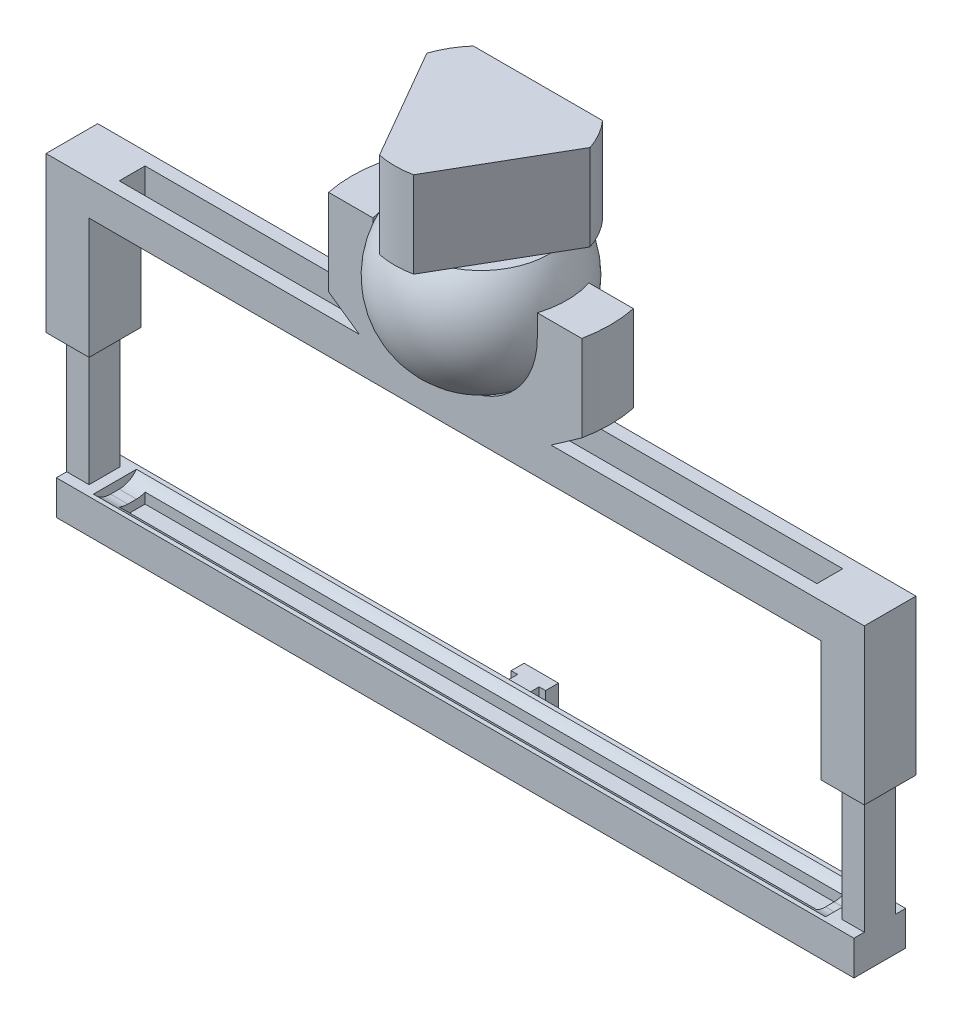
from build123d import *
from build123d.topology import SkipClean

# Parameters (mm, degrees)
BOSS_EXTRUDE1_DEPTH  = 6
SKETCH3_W            = 170.00000000000003
SKETCH3_H            = 10
CUT_EXTRUDE1_DEPTH   = 2
FILLET1_R            = 5
CUT_EXTRUDE2_START   = -72
SKETCH4_W            = 162
SKETCH4_H            = 6
CUT_EXTRUDE2_DEPTH   = 72
BOSS_EXTRUDE6_DEPTH  = 10
SKETCH11_W           = 6
SKETCH11_H           = 8.000000000000005
CUT_EXTRUDE4_DEPTH   = 20
SKETCH12_W           = 5.199999999999989
SKETCH12_H           = 7.200000000000005
BOSS_EXTRUDE7_DEPTH  = 55
SKETCH13_W           = 7.600000000000136
SKETCH13_H           = 12.000000000000005
BOSS_EXTRUDE8_DEPTH  = 8
BOSS_EXTRUDE9_DEPTH  = 72
CUT_EXTRUDE5_START   = -8
CUT_EXTRUDE5_DEPTH   = 8
BOSS_EXTRUDE10_DEPTH = 40
BOSS_EXTRUDE11_DEPTH = 31.5
SKETCH20_W           = 1.7999999999999998
SKETCH20_H           = 1.1499999999999995
CUT_EXTRUDE6_DEPTH   = 1
SKETCH21_W           = 1.4999999999999911
SKETCH21_H           = 1.5000000000000009
SKETCH21_W_2         = 1.5000000000000142
BOSS_EXTRUDE12_DEPTH = 1
CUT_EXTRUDE7_DEPTH   = 7.5
SKETCH23_W           = 1.5000000000000133
SKETCH23_H           = 1.5000000000000009
SKETCH23_W_2         = 1.499999999999993
BOSS_EXTRUDE13_DEPTH = 7.5
SKETCH24_W           = 162
SKETCH24_H           = 6
BOSS_EXTRUDE14_DEPTH = 4
CUT_EXTRUDE8_DEPTH   = 202.79444987412327
CUT_EXTRUDE9_DEPTH   = 36
SKETCH29_W           = 13.300000000000004
SKETCH29_H           = 1.000000000000008
BOSS_EXTRUDE15_DEPTH = 4
BOSS_EXTRUDE16_DEPTH = 5
SKETCH31_R           = 20
BOSS_EXTRUDE17_DEPTH = 20
CUT_EXTRUDE10_DEPTH  = 20
CIRPATTERN1_COUNT    = 3


with BuildPart() as part:
    # Sketch2 → Boss-Extrude1 (new, symmetric)
    with BuildSketch(Plane.XY):
        Polygon((-85.00000000000001, 36.00000000000002), (84.99999999999999, 35.999999999999986), (85.00000000000001, 27.99999999999999), (-85.00000000000001, 27.999999999999968), align=None)
    extrude(amount=BOSS_EXTRUDE1_DEPTH, both=True)

    # Sketch3 → Cut-Extrude1 (cut)
    with BuildSketch(Plane.XZ.offset(-27.99999999999998)):
        Rectangle(SKETCH3_W, SKETCH3_H)
    extrude(amount=-CUT_EXTRUDE1_DEPTH, mode=Mode.SUBTRACT)

    # Fillet1
    # the kernel refuses this fillet: 5 mm, written as the material it adds along each edge
    with BuildSketch(Plane(origin=(85.00000000000001, 29.99999999999999, -5), x_dir=(1.3e-16, -1, 0), z_dir=(-1, -1.3e-16, 0))) as fillet1_piece_1:
        with BuildLine():
            CenterArc((5, 3.9999999999999996), FILLET1_R, 180, 53.13010235415595)
            Line((0, 3.9999999999999996), (-0.10000000000000142, 3.9999999999999996))
            Line((-0.10000000000000142, 3.9999999999999996), (-0.10000000000000142, 0))
            Line((-0.10000000000000142, 0), (0, -0.09999999999999964))
            ThreePointArc((0, -0.09999999999999964), (1, -0.09999999999999964), (1.9400000000000013, -0.08000000000000007))
            Line((1.9400000000000013, -0.08000000000000007), (2, 0))
        make_face()
    extrude(amount=170.00000000000003)
    with BuildSketch(Plane(origin=(-85.00000000000001, 29.999999999999968, 5), x_dir=(0, 0, -1), z_dir=(1, 1.3e-16, 0))) as fillet1_piece_2:
        with BuildLine():
            CenterArc((4, -5), FILLET1_R, 90, 53.13010235415598)
            Line((0, -2), (-0.08000000000000007, -1.9400000000000013))
            ThreePointArc((-0.08000000000000007, -1.9400000000000013), (-0.09999999999999964, -1), (-0.09999999999999964, 0))
            Line((-0.09999999999999964, 0), (0, 0.10000000000000142))
            Line((0, 0.10000000000000142), (4, 0.10000000000000142))
            Line((4, 0.10000000000000142), (4, 0))
        make_face()
    extrude(amount=170.00000000000003)


with BuildPart() as body_2:
    # Mirror3: mirrored copy
    add(part.part.mirror(Plane.ZX))


with BuildPart() as cut_extrude2_tool:
    # Sketch4 → Cut-Extrude2 (new body)
    with BuildSketch(Plane(origin=(7.35e-15, 36.00000000000001, 0), x_dir=(1, -1e-16, 0), z_dir=(1e-16, 1, 0)).offset(CUT_EXTRUDE2_START)):
        Rectangle(SKETCH4_W, SKETCH4_H)
    extrude(amount=CUT_EXTRUDE2_DEPTH)


with BuildPart() as part_1:
    add(part.part)

    # Cut-Extrude2: cut by cut_extrude2_tool
    add(cut_extrude2_tool.part, mode=Mode.SUBTRACT)

    # Sketch10 → Boss-Extrude6 (add)
    with BuildSketch(Plane(origin=(85.00000000000011, 2.949e-13, 0), x_dir=(0, 0, -1), z_dir=(1, 3.47e-15, 0))):
        Polygon((-6, 35.99999999999969), (6, 35.99999999999969), (6.000000000000005, 0), (-6, 0), align=None)
    boss_extrude6 = extrude(amount=BOSS_EXTRUDE6_DEPTH)

    # Sketch11 → Cut-Extrude4 (cut)
    with BuildSketch(Plane.XZ):
        with Locations((90.00000000000011, -2.66e-15)):
            Rectangle(SKETCH11_W, SKETCH11_H)
    cut_extrude4 = extrude(amount=-CUT_EXTRUDE4_DEPTH, mode=Mode.SUBTRACT)

    # Mirror4: Boss-Extrude6, Cut-Extrude4 across plane
    add(boss_extrude6.mirror(Plane(origin=(0, 0, 0), x_dir=(0, 0, 1), z_dir=(1, 0, 0))))
    add(cut_extrude4.mirror(Plane(origin=(0, 0, 0), x_dir=(0, 0, 1), z_dir=(1, 0, 0))), mode=Mode.SUBTRACT)



with BuildPart() as body_2_1:
    add(body_2.part)

    # Cut-Extrude2: cut by cut_extrude2_tool
    add(cut_extrude2_tool.part, mode=Mode.SUBTRACT)



with BuildPart() as body_3:
    # Sketch12 → Boss-Extrude7 (new body)
    with BuildSketch(Plane(origin=(-6.592e-14, 19, 0), x_dir=(-1, -3.47e-15, 0), z_dir=(3.47e-15, -1, 0))):
        with Locations((-90.00000000000011, 2.22e-15)):
            Rectangle(SKETCH12_W, SKETCH12_H)
    extrude(amount=BOSS_EXTRUDE7_DEPTH)


with BuildPart() as body_2_2:
    add(body_2_1.part)

    add(body_3.part)  # Boss-Extrude8 merges body 3
    # Sketch13 → Boss-Extrude8 (add)
    with BuildSketch(Plane.XZ.offset(36.00000000000001)):
        with Locations((88.80000000000018, -2.66e-15)):
            Rectangle(SKETCH13_W, SKETCH13_H)
    boss_extrude8 = extrude(amount=-BOSS_EXTRUDE8_DEPTH)

    # Mirror7: Boss-Extrude8 across plane
    add(boss_extrude8.mirror(Plane(origin=(0, 0, 0), x_dir=(0, 0, 1), z_dir=(1, 0, 0))))


with BuildPart() as body_3_2:
    # Mirror9: mirrored copy
    add(body_2_2.part.mirror(Plane(origin=(0, 0, 0), x_dir=(0, 0, 1), z_dir=(1, 0, 0))))


with BuildPart() as part_2:
    add(part_1.part)

    add(body_2_2.part)  # Boss-Extrude9 merges body 2

    add(body_3_2.part)  # Boss-Extrude9 merges body 3 2
    # Sketch16 → Boss-Extrude9 (add)
    with BuildSketch(Plane(origin=(7.35e-15, 36.00000000000001, 0), x_dir=(1, -2e-16, 0), z_dir=(2e-16, 1, 0))):
        Polygon((-2.5, 6), (2.5, 6), (2.5, 11), (4, 11), (4, 14.000000000000002), (-4, 13.999999999999998), (-4, 11), (-2.5, 11), align=None)
    extrude(amount=-BOSS_EXTRUDE9_DEPTH)

    # Sketch17 → Cut-Extrude5 (cut)
    with BuildSketch(Plane(origin=(-6.07e-15, 0, -14), x_dir=(-1, 0, 4.3e-16), z_dir=(-4.3e-16, 0, -1)).offset(CUT_EXTRUDE5_START)):
        Polygon((-3.9999999999999982, 31), (4.000000000000005, 31.000000000000004), (4.000000000000005, -31.000000000000004), (-3.9999999999999907, -31), align=None)
    extrude(amount=CUT_EXTRUDE5_DEPTH, mode=Mode.SUBTRACT)


with BuildPart() as cut_extrude5_piece_1:
    # of the separate pieces the step leaves, piece 1, a body of its own (cut_extrude5_pieces)
    add(part_2.part.solids().sort_by_distance((85, 28, -5))[0])

    # Sketch20 → Cut-Extrude6 (cut)
    with BuildSketch(Plane.XZ.offset(-27.99999999999998)):
        with Locations((-5.750000000000002, -5.425000000000001)):
            Rectangle(SKETCH20_W, SKETCH20_H)
        Polygon((6.649999999999999, -6), (4.849999999999999, -6), (4.850000000000002, -4.85), (6.650000000000002, -4.849999999999999), align=None)
    extrude(amount=-CUT_EXTRUDE6_DEPTH, mode=Mode.SUBTRACT)

    # Sketch22 → Cut-Extrude7 (cut)
    with BuildSketch(Plane(origin=(7.35e-15, 36.00000000000001, 0), x_dir=(1, -2e-16, 0), z_dir=(2e-16, 1, 0))):
        Polygon((4.850000000000007, 6), (6.65, 6), (6.65, 4.849999999999999), (4.850000000000002, 4.849999999999999), align=None)
        Polygon((-4.850000000000001, 4.849999999999998), (-6.649999999999999, 4.849999999999997), (-6.65, 6), (-4.850000000000007, 6), align=None)
    extrude(amount=-CUT_EXTRUDE7_DEPTH, mode=Mode.SUBTRACT)



with BuildPart() as cut_extrude5_piece_2:
    # of the separate pieces the step leaves, piece 2, a body of its own (cut_extrude5_pieces)
    add(part_2.part.solids().sort_by_distance((85, -30, 1))[0])

    # Sketch24 → Boss-Extrude14 (add)
    with BuildSketch(Plane.XZ.offset(36.00000000000001)):
        Rectangle(SKETCH24_W, SKETCH24_H)
    extrude(amount=-BOSS_EXTRUDE14_DEPTH)


with BuildPart() as body_3_3:
    # Sketch18 → Boss-Extrude10 (new body)
    with BuildSketch(Plane(origin=(7.35e-15, 36.00000000000001, 0), x_dir=(1, -2e-16, 0), z_dir=(2e-16, 1, 0))):
        Polygon((-5, 6.500000000000001), (-5.000000000000003, 14.500000000000002), (5.000000000000003, 14.500000000000002), (5, 6.500000000000001), (6.500000000000001, 6.500000000000001), (6.500000000000001, 16.000000000000004), (-6.500000000000001, 16.000000000000004), (-6.500000000000001, 6.500000000000001), align=None)
    extrude(amount=-BOSS_EXTRUDE10_DEPTH)

    # Sketch19 → Boss-Extrude11 (add)
    with BuildSketch(Plane.XZ.offset(3.9999999999999964)):
        Polygon((-6.500000000000002, -6.500000000000001), (6.5, -6.500000000000001), (6.5, -5), (-6.500000000000005, -5), align=None)
    extrude(amount=-BOSS_EXTRUDE11_DEPTH)

    # Sketch21 → Boss-Extrude12 (add)
    with BuildSketch(Plane(origin=(-3.37e-15, 27.49999999999998, 0), x_dir=(1, 1.2e-16, 0), z_dir=(-1.2e-16, 1, 0))):
        with Locations((5.750000000000007, 5.75)):
            Rectangle(SKETCH21_W, SKETCH21_H)
        with Locations((-5.749999999999996, 5.75)):
            Rectangle(SKETCH21_W_2, SKETCH21_H)
    extrude(amount=BOSS_EXTRUDE12_DEPTH)

    # Sketch23 → Boss-Extrude13 (add)
    with BuildSketch(Plane(origin=(0, 28.49999999999998, 0), x_dir=(1, 0, 0), z_dir=(0, 1, 0))):
        with Locations((-5.749999999999998, 5.75)):
            Rectangle(SKETCH23_W, SKETCH23_H)
        with Locations((5.750000000000004, 5.75)):
            Rectangle(SKETCH23_W_2, SKETCH23_H)
    extrude(amount=BOSS_EXTRUDE13_DEPTH)


with BuildPart() as cut_extrude5_piece_1_1:
    add(cut_extrude5_piece_1.part)

    add(body_3_3.part)  # Revolve4 merges body 3 3
    # Sketch25 → Revolve4 (revolve)
    with BuildSketch(Plane.XY):
        with BuildLine():
            Line((-17.5, 32.00000000000001), (0, 32.00000000000001))
            Line((0, 32.00000000000001), (-3.67e-15, 36.00000000000002))
            ThreePointArc((-3.89e-15, 36.000000000000014), (-14.142135623730956, 41.85786437626906), (-20.000000000000004, 56.00000000000002))
            Line((-20.000000000000007, 56.00000000000002), (-30, 56.00000000000002))
            Line((-30, 56.00000000000002), (-30, 41.00000000000002))
            Line((-30, 41.00000000000002), (-17.5, 32.00000000000001))
        make_face()
        Polygon((30, 61.00000000000002), (30, 56.00000000000002), (20.000000000000007, 56.00000000000002), (20, 61.00000000000002), align=None)
    revolve(axis=Axis((-3.67e-15, 36.00000000000002, 0), (1.8e-16, 1, 0)))

    # Sketch26 → Cut-Extrude8 (cut, through all)
    with BuildSketch(Plane.ZY.offset(95.00000000000011)):
        Polygon((-6.000000000000001, 31.999999999999993), (-30, 31.999999999999993), (-30, 61.00000000000003), (-6.000000000000006, 61.00000000000003), (-6, 35.999999999999936), align=None)
        Polygon((30, 61.00000000000003), (30, 31.999999999999993), (6, 31.999999999999947), (6, 35.999999999999936), (5.999999999999999, 61.00000000000003), align=None)
    extrude(amount=-CUT_EXTRUDE8_DEPTH, mode=Mode.SUBTRACT)

    # Sketch28 → Cut-Extrude9 (cut)
    with BuildSketch(Plane.XZ.offset(3.9999999999999964)):
        Polygon((6.5, -16.000000000000004), (6.5, -5), (-6.500000000000005, -5), (-6.500000000000002, -16.000000000000004), align=None)
    extrude(amount=-CUT_EXTRUDE9_DEPTH, mode=Mode.SUBTRACT)

    # Sketch29 → Boss-Extrude15 (add)
    with BuildSketch(Plane.XZ.offset(-27.99999999999998)):
        with Locations((0, -5.4999999999999964)):
            Rectangle(SKETCH29_W, SKETCH29_H)
    extrude(amount=-BOSS_EXTRUDE15_DEPTH)


with BuildPart() as body_3_4:
    # Sketch27 → Revolve6 (revolve)
    with SkipClean():  # the faces are left unmerged after this step: merging them gives an invalid solid
        with BuildSketch(Plane.XY):
            with BuildLine():
                ThreePointArc((19.7, 56.00000000000002), (13.930003589374987, 69.930003589375), (1.21e-15, 75.70000000000002))
                Line((0, 75.70000000000002), (0, 36.300000000000026))
                ThreePointArc((-3.62e-15, 36.300000000000026), (13.930003589374982, 42.06999641062503), (19.7, 56.000000000000014))
            make_face()
            with BuildLine():
                Line((0, 36.300000000000026), (0, 75.70000000000002))
                ThreePointArc((1.21e-15, 75.70000000000002), (-19.7, 56.00000000000002), (-3.62e-15, 36.300000000000026))
            make_face()
        revolve(axis=Axis((0, 75.70000000000002, 0), (0, -1, 0)))

    # Sketch31 → Boss-Extrude17 (add)
    with SkipClean():  # the faces are left unmerged after this step: merging them gives an invalid solid
        with BuildSketch(Plane(origin=(1.249e-14, 68.00000000000003, 0), x_dir=(1, -1.8e-16, 0), z_dir=(1.8e-16, 1, 0))):
            with Locations(Location((0, 0, 0), (0, 0, 180))):
                Circle(SKETCH31_R)
        extrude(amount=BOSS_EXTRUDE17_DEPTH)

    # Sketch32 → Cut-Extrude10 (cut)
    with SkipClean():  # the faces are left unmerged after this step: merging them gives an invalid solid
        with BuildSketch(Plane(origin=(1.617e-14, 88.00000000000004, 0), x_dir=(1, -1.8e-16, 0), z_dir=(1.8e-16, 1, 0))):
            with BuildLine():
                Line((-15, 13.228756555322956), (15, 13.228756555322956))
                ThreePointArc((15, 13.228756555322956), (1.22e-15, 20.000000000000004), (-15, 13.228756555322956))
            make_face()
        cut_extrude10 = extrude(amount=-CUT_EXTRUDE10_DEPTH, mode=Mode.SUBTRACT)

    # CirPattern1: Cut-Extrude10 ×3 about axis
    with SkipClean():  # the faces are left unmerged after this step: merging them gives an invalid solid
        cirpattern1_axis = Axis((-6.01e-15, 0, -1.16e-15), (0, 1, 0))
        for i in range(1, CIRPATTERN1_COUNT):
            add(cut_extrude10.rotate(cirpattern1_axis, i * 360 / CIRPATTERN1_COUNT), mode=Mode.SUBTRACT)


with BuildPart() as body_4:
    # Sketch30 → Boss-Extrude16 (new body)
    with BuildSketch(Plane.XZ.offset(-27.99999999999998)):
        Polygon((-4.000000000000016, -13.999999999999998), (3.999999999999988, -14.000000000000002), (4.000000000000003, -11), (2.4999999999999885, -11), (2.499999999999984, -6), (-2.5000000000000138, -6), (-2.499999999999997, -11), (-4.000000000000012, -11), align=None)
    extrude(amount=-BOSS_EXTRUDE16_DEPTH)


solid = Compound([cut_extrude5_piece_2.part, cut_extrude5_piece_1_1.part, body_3_4.part, body_4.part])
